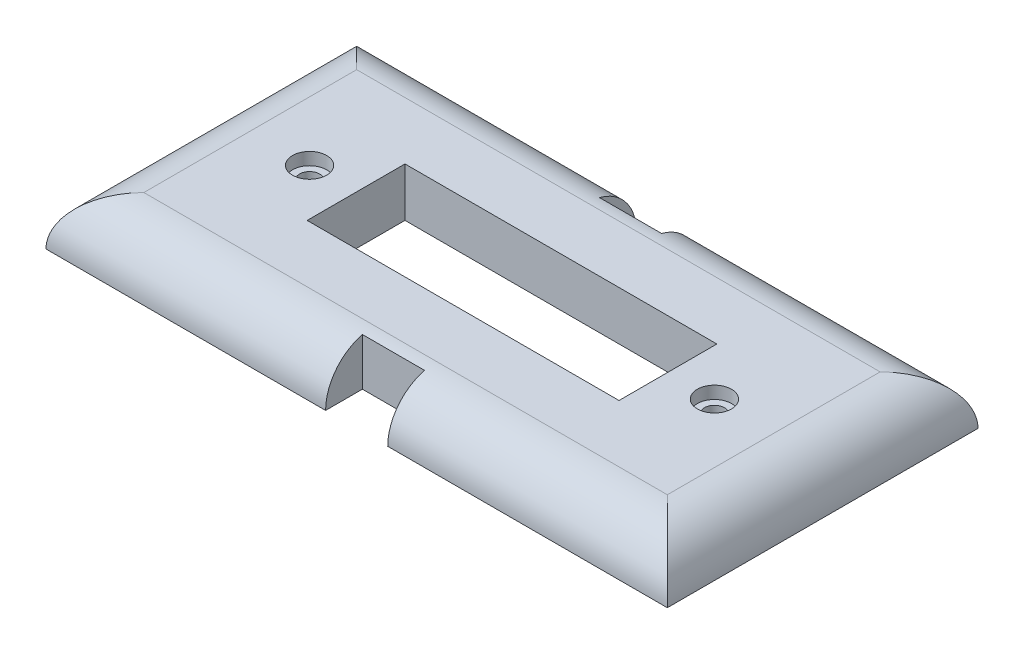
from build123d import *

# Parameters (mm, degrees)
SKETCH2_W           = 101.6
SKETCH2_H           = 50.8
BOSS_EXTRUDE1_DEPTH = 8
SKETCH3_W           = 51
SKETCH3_H           = 16
CUT_EXTRUDE1_DEPTH  = 58.356778152
FILLET1_R           = 8
SKETCH5_R           = 1.63195
CUT_EXTRUDE2_DEPTH  = 58.356778152
SKETCH6_R           = 1.63195
CUT_EXTRUDE3_DEPTH  = 58.356778152
SKETCH7_W           = 10.16
SKETCH7_H           = 6.016
CUT_EXTRUDE4_DEPTH  = 58.356778152
SKETCH8_W           = 10.16
SKETCH8_H           = 6.016
CUT_EXTRUDE5_DEPTH  = 58.356778152
SKETCH9_R           = 2.794
CUT_EXTRUDE6_DEPTH  = 2.032
SKETCH10_R          = 2.794
CUT_EXTRUDE7_DEPTH  = 2.032


with BuildPart() as part:
    # Sketch2 → Boss-Extrude1 (new body)
    with BuildSketch(Plane(origin=(0, 0, 0), x_dir=(1, 0, 0), z_dir=(0, 1, 0))):
        Rectangle(SKETCH2_W, SKETCH2_H)
    extrude(amount=BOSS_EXTRUDE1_DEPTH)

    # Sketch3 → Cut-Extrude1 (cut, through all)
    with BuildSketch(Plane(origin=(0, 8, 0), x_dir=(1, 0, 0), z_dir=(0, 1, 0))):
        Rectangle(SKETCH3_W, SKETCH3_H)
    extrude(amount=-CUT_EXTRUDE1_DEPTH, mode=Mode.SUBTRACT)

    # Fillet1
    fillet1_edges = [part.edges().sort_by_distance(p)[0] for p in [
        (0, 8, -25.4),
        (50.8, 8, 0),
        (0, 8, 25.4),
        (-50.8, 8, 0),
    ]]
    fillet(fillet1_edges, radius=FILLET1_R - 0.0001)  # a hair under: the kernel refuses the full size

    # Sketch5 → Cut-Extrude2 (cut, through all)
    with BuildSketch(Plane.XZ):
        with Locations(Location((-33.1, 0, 0), (0, 0, 270))):
            Circle(SKETCH5_R)
    extrude(amount=-CUT_EXTRUDE2_DEPTH, mode=Mode.SUBTRACT)

    # Sketch6 → Cut-Extrude3 (cut, through all)
    with BuildSketch(Plane.XZ):
        with Locations(Location((33.1, 0, 0), (0, 0, 270))):
            Circle(SKETCH6_R)
    extrude(amount=-CUT_EXTRUDE3_DEPTH, mode=Mode.SUBTRACT)

    # Sketch7 → Cut-Extrude4 (cut, through all)
    with BuildSketch(Plane.XZ):
        with Locations((0, 22.392)):
            Rectangle(SKETCH7_W, SKETCH7_H)
    extrude(amount=-CUT_EXTRUDE4_DEPTH, mode=Mode.SUBTRACT)

    # Sketch8 → Cut-Extrude5 (cut, through all)
    with BuildSketch(Plane.XZ):
        with Locations((0, -22.392)):
            Rectangle(SKETCH8_W, SKETCH8_H)
    extrude(amount=-CUT_EXTRUDE5_DEPTH, mode=Mode.SUBTRACT)

    # Sketch9 → Cut-Extrude6 (cut)
    with BuildSketch(Plane(origin=(0, 8, 0), x_dir=(1, 0, 0), z_dir=(0, 1, 0))):
        with Locations(Location((-33.1, 0, 0), (0, 0, 270))):
            Circle(SKETCH9_R)
    extrude(amount=-CUT_EXTRUDE6_DEPTH, mode=Mode.SUBTRACT)

    # Sketch10 → Cut-Extrude7 (cut)
    with BuildSketch(Plane(origin=(0, 8, 0), x_dir=(1, 0, 0), z_dir=(0, 1, 0))):
        with Locations(Location((33.1, 0, 0), (0, 0, 270))):
            Circle(SKETCH10_R)
    extrude(amount=-CUT_EXTRUDE7_DEPTH, mode=Mode.SUBTRACT)


solid = part.part
